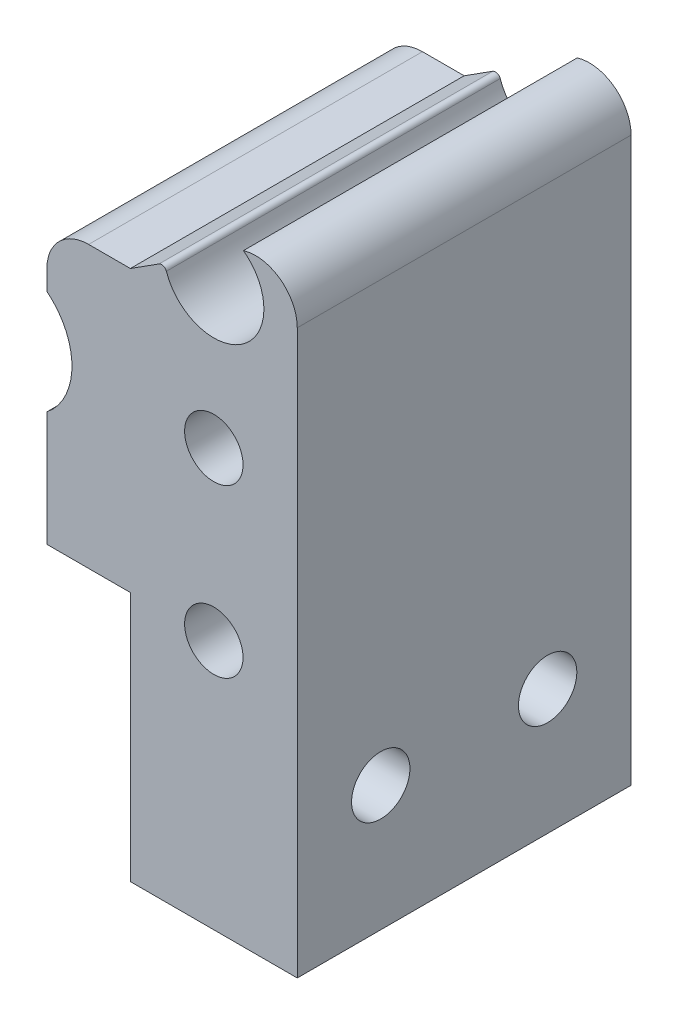
from build123d import *

# Parameters (mm, degrees)
BOSS_EXTRUDE1_DEPTH = 20
SKETCH3_R           = 1.75
CUT_EXTRUDE1_DEPTH  = 46.641220998
SKETCH4_R           = 3
SKETCH4_R_2         = 1.75
SKETCH4_R_3         = 4
CUT_EXTRUDE2_DEPTH  = 45.250661625
FILLET2_R           = 2.5
FILLET3_R           = 0.3


with BuildPart() as part:
    # Sketch2 → Boss-Extrude1 (new body)
    with BuildSketch(Plane.XY):
        Polygon((0, 0), (0, 15), (-5, 15), (-5, 31.814648696), (0, 31.814648696), (10, 38.185351304), (10, 0), align=None)
    extrude(amount=BOSS_EXTRUDE1_DEPTH)

    # Sketch3 → Cut-Extrude1 (cut, through all)
    with BuildSketch(Plane(origin=(10, 0, 0), x_dir=(0, 0, -1), z_dir=(1, 0, 0))):
        with Locations((-15, 7.5)):
            Circle(SKETCH3_R)
        with Locations((-5, 7.5)):
            Circle(SKETCH3_R)
    extrude(amount=-CUT_EXTRUDE1_DEPTH, mode=Mode.SUBTRACT)

    # Sketch4 → Cut-Extrude2 (cut, through all)
    with BuildSketch(Plane.XY.offset(20)):
        with Locations((5, 33.71)):
            Circle(SKETCH4_R)
        with Locations((5, 25)):
            Circle(SKETCH4_R_2)
        with Locations((-7.5, 25)):
            Circle(SKETCH4_R_3)
        with Locations((5, 15)):
            Circle(SKETCH4_R_2)
    extrude(amount=-CUT_EXTRUDE2_DEPTH, mode=Mode.SUBTRACT)

    # Fillet2
    # the kernel refuses this fillet: 2.5 mm, written as the material it takes off along each edge
    with BuildSketch(Plane(origin=(10, 38.185351304, -11.119166033), x_dir=(0, -1, 0), z_dir=(0, 0, 1))) as fillet2_piece_1:
        with BuildLine():
            CenterArc((4.447666413, -2.5), FILLET2_R, 90, 106.897304497)
            Line((2.055598265, -3.226642949), (2.007756902, -3.241175808))
            ThreePointArc((2.007756902, -3.241175808), (0.98562956, -1.640186455), (-0.042169572, -0.02686498))
            Line((-0.042169572, -0.02686498), (0, 0.05))
            Line((0, 0.05), (4.447666413, 0.05))
            Line((4.447666413, 0.05), (4.447666413, 0))
        make_face()
    extrude(amount=42.238332065, mode=Mode.SUBTRACT)
    with BuildSketch(Plane(origin=(-5, 31.814648696, -6.25), x_dir=(1, 0, 0), z_dir=(0, 0, 1))) as fillet2_piece_2:
        with BuildLine():
            CenterArc((FILLET2_R, -FILLET2_R), FILLET2_R, 90, 90)
            Line((0, -FILLET2_R), (-FILLET2_R * 0.02, -FILLET2_R))
            Line((-FILLET2_R * 0.02, -FILLET2_R), (-FILLET2_R * 0.02, FILLET2_R * 0.02))
            Line((-FILLET2_R * 0.02, FILLET2_R * 0.02), (FILLET2_R, FILLET2_R * 0.02))
            Line((FILLET2_R, FILLET2_R * 0.02), (FILLET2_R, 0))
        make_face()
    extrude(amount=32.5, mode=Mode.SUBTRACT)

    # Fillet3
    fillet3_edges = [part.edges().sort_by_distance(p)[0] for p in [
        (2.057505904, 33.125424519, 10),
    ]]
    fillet(fillet3_edges, radius=FILLET3_R)


solid = part.part
